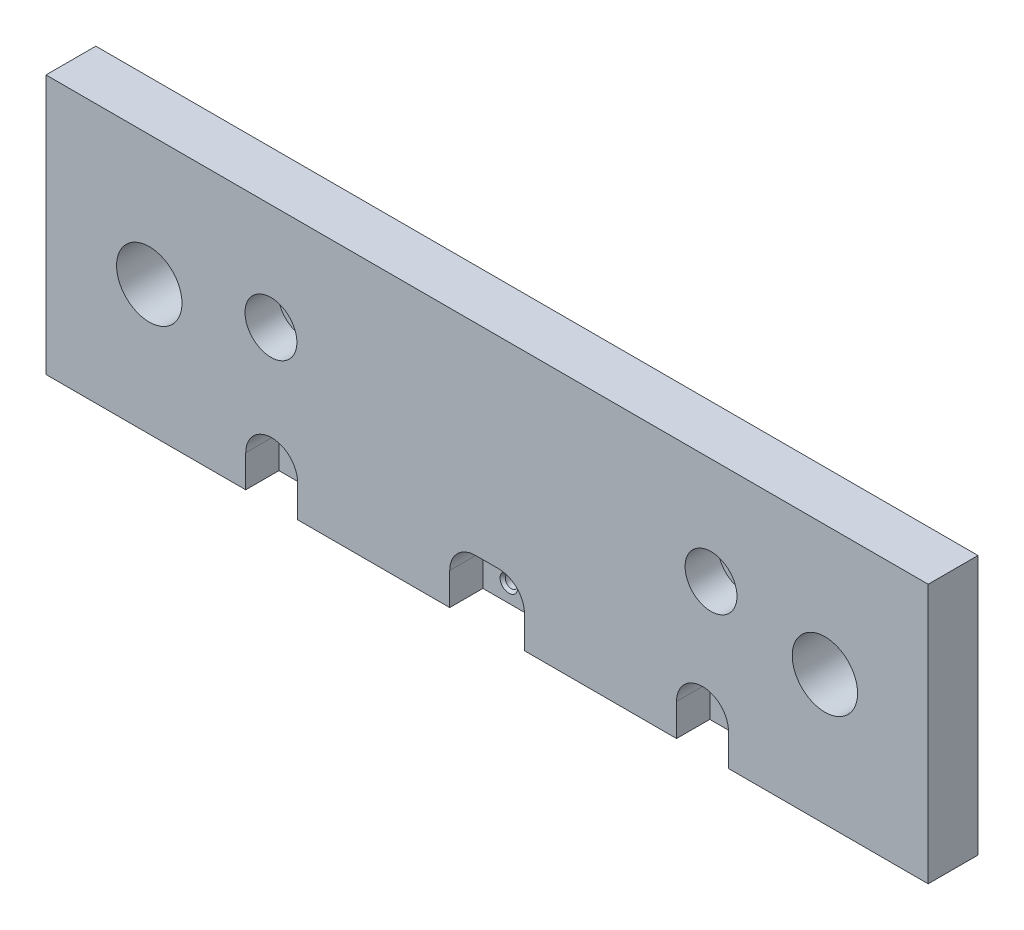
from build123d import *

# Parameters (mm, degrees)
SKETCH1_W           = 85
SKETCH1_H           = 25
BOSS_EXTRUDE1_DEPTH = 6.3
SKETCH2_R           = 3.15
CUT_EXTRUDE1_DEPTH  = 45.745837795
SKETCH3_R           = 4.95
SKETCH3_W           = 45
SKETCH3_H           = 17.4
CUT_EXTRUDE3_DEPTH  = 1.5
SKETCH4_R           = 0.6
CUT_EXTRUDE4_DEPTH  = 45.745837795
SKETCH6_R           = 0.6
CUT_EXTRUDE5_DEPTH  = 45.745837795
SKETCH8_R           = 2.5
CUT_EXTRUDE6_DEPTH  = 3.2
CHAMFER1_SIZE       = 0.25


with BuildPart() as part:
    # Sketch1 → Boss-Extrude1 (new body)
    with BuildSketch(Plane.XY):
        Rectangle(SKETCH1_W, SKETCH1_H)
    extrude(amount=BOSS_EXTRUDE1_DEPTH)

    # Sketch2 → Cut-Extrude1 (cut, through all)
    with BuildSketch(Plane.XY.offset(6.3)):
        with Locations((32.55, 0)):
            Circle(SKETCH2_R)
        with Locations((-32.55, 0)):
            Circle(SKETCH2_R)
    extrude(amount=-CUT_EXTRUDE1_DEPTH, mode=Mode.SUBTRACT)

    # Sketch3 → Cut-Extrude3 (cut)
    with BuildSketch(Plane(origin=(0, 0, 0), x_dir=(-1, 0, 0), z_dir=(0, 0, -1))):
        Polygon((-45.439513652, -14.921110138), (-45.439513652, 15.191583433), (44.718251531, 15.191583433), (44.718251531, -15.912845555), align=None)
        with Locations((-32.55, 0)):
            Circle(SKETCH3_R, mode=Mode.SUBTRACT)
        with Locations((32.55, 0)):
            Circle(SKETCH3_R, mode=Mode.SUBTRACT)
        Rectangle(SKETCH3_W, SKETCH3_H, mode=Mode.SUBTRACT)
    extrude(amount=-CUT_EXTRUDE3_DEPTH, mode=Mode.SUBTRACT)

    # Sketch4 → Cut-Extrude4 (cut, through all)
    with BuildSketch(Plane.XY.offset(6.3)):
        with Locations((-1.1, -10.8)):
            Circle(SKETCH4_R)
        with Locations((1.1, -10.8)):
            Circle(SKETCH4_R)
        with Locations((-20.755, -10.8)):
            Circle(SKETCH4_R)
        with Locations((20.755, -10.8)):
            Circle(SKETCH4_R)
        with Locations((-1.1, -9.4)):
            Circle(SKETCH4_R)
        with Locations((1.1, -9.4)):
            Circle(SKETCH4_R)
        with Locations((20.755, -9.4)):
            Circle(SKETCH4_R)
        with Locations((-20.755, -9.4)):
            Circle(SKETCH4_R)
    extrude(amount=-CUT_EXTRUDE4_DEPTH, mode=Mode.SUBTRACT)

    # Sketch6 → Cut-Extrude5 (cut, through all)
    with BuildSketch(Plane.XY.offset(6.3)):
        with Locations((-20.825, 2.27)):
            Circle(SKETCH6_R)
        with Locations((21.575, 2.27)):
            Circle(SKETCH6_R)
    extrude(amount=-CUT_EXTRUDE5_DEPTH, mode=Mode.SUBTRACT)

    # Sketch8 → Cut-Extrude6 (cut)
    with BuildSketch(Plane.XY.offset(6.3)):
        with Locations((-20.825, 2.27)):
            Circle(SKETCH8_R)
        with Locations((21.575, 2.27)):
            Circle(SKETCH8_R)
        with BuildLine():
            Line((18.255, -12.5), (23.255, -12.5))
            Line((23.255, -12.5), (23.255, -9.4))
            ThreePointArc((23.255, -9.4), (20.755, -6.9), (18.255, -9.4))
            Line((18.255, -9.4), (18.255, -12.5))
        make_face()
        with BuildLine():
            Line((-1.1, -6.9), (1.1, -6.9))
            ThreePointArc((1.1, -6.9), (2.867766953, -7.632233047), (3.6, -9.4))
            Line((3.6, -9.4), (3.6, -12.5))
            Line((3.6, -12.5), (-3.6, -12.5))
            Line((-3.6, -12.5), (-3.6, -9.4))
            ThreePointArc((-3.6, -9.4), (-2.867766953, -7.632233047), (-1.1, -6.9))
        make_face()
        with BuildLine():
            Line((-23.255, -12.5), (-18.255, -12.5))
            Line((-18.255, -12.5), (-18.255, -9.4))
            ThreePointArc((-18.255, -9.4), (-20.755, -6.9), (-23.255, -9.4))
            Line((-23.255, -9.4), (-23.255, -12.5))
        make_face()
    extrude(amount=-CUT_EXTRUDE6_DEPTH, mode=Mode.SUBTRACT)

    # Chamfer1
    # the kernel refuses this chamfer: 0.25 mm, written as the material it takes off along each edge
    with BuildSketch(Plane(origin=(20.755, -9.4, 3.1), x_dir=(1, 0, 0), z_dir=(0, -1, 0))) as chamfer1_piece_1:
        Polygon((0.6, -CHAMFER1_SIZE), (0.6 + CHAMFER1_SIZE, 0), (0.6, 0), align=None)
    revolve(axis=Axis((20.755, -9.4, 3.1), (0, 0, 1)), mode=Mode.SUBTRACT)
    with BuildSketch(Plane(origin=(20.755, -10.8, 3.1), x_dir=(1, 0, 0), z_dir=(0, -1, 0))) as chamfer1_piece_2:
        Polygon((0.6, -CHAMFER1_SIZE), (0.6 + CHAMFER1_SIZE, 0), (0.6, 0), align=None)
    revolve(axis=Axis((20.755, -10.8, 3.1), (0, 0, 1)), mode=Mode.SUBTRACT)
    with BuildSketch(Plane(origin=(-20.825, 2.27, 3.1), x_dir=(1, 0, 0), z_dir=(0, -1, 0))) as chamfer1_piece_3:
        Polygon((0.6 + CHAMFER1_SIZE, 0), (0.6, -CHAMFER1_SIZE), (0.6, 0), align=None)
    revolve(axis=Axis((-20.825, 2.27, 3.1), (0, 0, 1)), mode=Mode.SUBTRACT)
    with BuildSketch(Plane(origin=(-20.755, -9.4, 3.1), x_dir=(1, 0, 0), z_dir=(0, -1, 0))) as chamfer1_piece_4:
        Polygon((0.6, -CHAMFER1_SIZE), (0.6 + CHAMFER1_SIZE, 0), (0.6, 0), align=None)
    revolve(axis=Axis((-20.755, -9.4, 3.1), (0, 0, 1)), mode=Mode.SUBTRACT)
    with BuildSketch(Plane(origin=(-20.755, -10.8, 3.1), x_dir=(1, 0, 0), z_dir=(0, -1, 0))) as chamfer1_piece_5:
        Polygon((0.6, -CHAMFER1_SIZE), (0.6 + CHAMFER1_SIZE, 0), (0.6, 0), align=None)
    revolve(axis=Axis((-20.755, -10.8, 3.1), (0, 0, 1)), mode=Mode.SUBTRACT)
    with BuildSketch(Plane(origin=(21.575, 2.27, 3.1), x_dir=(1, 0, 0), z_dir=(0, -1, 0))) as chamfer1_piece_6:
        Polygon((0.6 + CHAMFER1_SIZE, 0), (0.6, -CHAMFER1_SIZE), (0.6, 0), align=None)
    revolve(axis=Axis((21.575, 2.27, 3.1), (0, 0, 1)), mode=Mode.SUBTRACT)
    with BuildSketch(Plane(origin=(-1.1, -10.8, 3.1), x_dir=(1, 0, 0), z_dir=(0, -1, 0))) as chamfer1_piece_7:
        Polygon((0.6, -CHAMFER1_SIZE), (0.6 + CHAMFER1_SIZE, 0), (0.6, 0), align=None)
    revolve(axis=Axis((-1.1, -10.8, 3.1), (0, 0, 1)), mode=Mode.SUBTRACT)
    with BuildSketch(Plane(origin=(1.1, -9.4, 3.1), x_dir=(1, 0, 0), z_dir=(0, -1, 0))) as chamfer1_piece_8:
        Polygon((0.6, -CHAMFER1_SIZE), (0.6 + CHAMFER1_SIZE, 0), (0.6, 0), align=None)
    revolve(axis=Axis((1.1, -9.4, 3.1), (0, 0, 1)), mode=Mode.SUBTRACT)
    with BuildSketch(Plane(origin=(1.1, -10.8, 3.1), x_dir=(1, 0, 0), z_dir=(0, -1, 0))) as chamfer1_piece_9:
        Polygon((0.6, -CHAMFER1_SIZE), (0.6 + CHAMFER1_SIZE, 0), (0.6, 0), align=None)
    revolve(axis=Axis((1.1, -10.8, 3.1), (0, 0, 1)), mode=Mode.SUBTRACT)
    with BuildSketch(Plane(origin=(-1.1, -9.4, 3.1), x_dir=(1, 0, 0), z_dir=(0, -1, 0))) as chamfer1_piece_10:
        Polygon((0.6, -CHAMFER1_SIZE), (0.6 + CHAMFER1_SIZE, 0), (0.6, 0), align=None)
    revolve(axis=Axis((-1.1, -9.4, 3.1), (0, 0, 1)), mode=Mode.SUBTRACT)


solid = part.part
